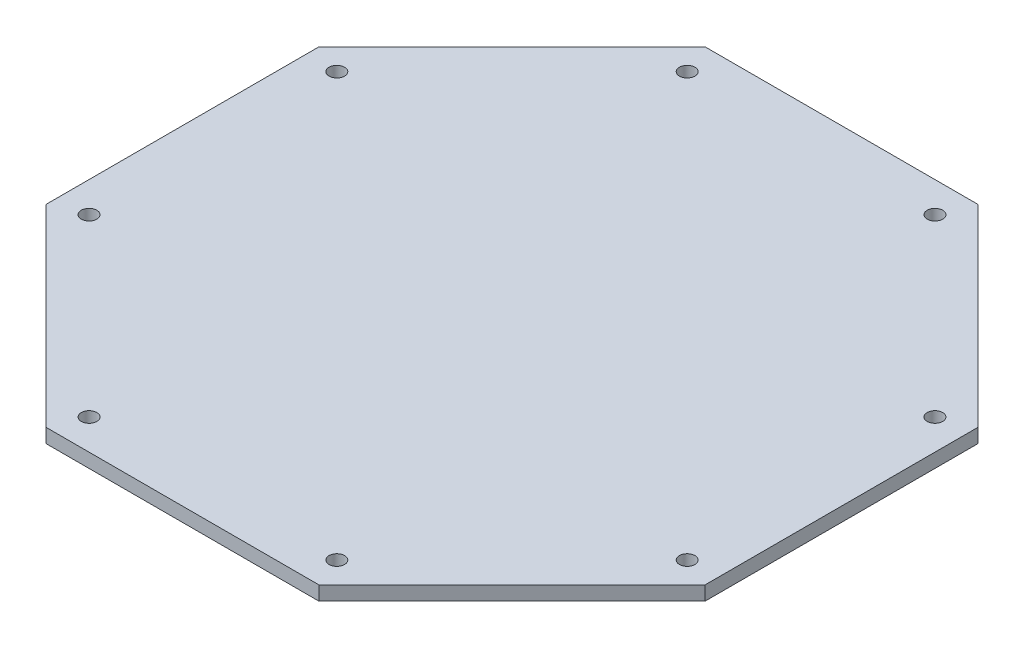
from build123d import *

# Parameters (mm, degrees)
RESSALTO_EXTRUS_O1_DEPTH = 1.5
ESBO_O2_R                = 1.65
CORTE_EXTRUS_O1_DEPTH    = 100.040395799


with BuildPart() as part:
    # Esboço1 → Ressalto-extrusão1 (new, symmetric)
    with BuildSketch(Plane(origin=(0, 0, 0), x_dir=(1, 0, 0), z_dir=(0, 1, 0))):
        Polygon((70, 28.994949366), (28.994949366, 70), (-28.994949366, 70), (-70, 28.994949366), (-70, -28.994949366), (-28.994949366, -70), (28.994949366, -70), (70, -28.994949366), align=None)
    extrude(amount=RESSALTO_EXTRUS_O1_DEPTH, both=True)

    # Esboço2 → Corte-extrusão1 (cut, through all)
    with BuildSketch(Plane.XZ.offset(1.5)):
        with Locations((-26.31616534, 63.532843272)):
            Circle(ESBO_O2_R)
        with Locations((26.31616534, 63.532843272)):
            Circle(ESBO_O2_R)
        with Locations((63.532843272, 26.31616534)):
            Circle(ESBO_O2_R)
        with Locations((63.532843272, -26.31616534)):
            Circle(ESBO_O2_R)
        with Locations((26.31616534, -63.532843272)):
            Circle(ESBO_O2_R)
        with Locations((-26.31616534, -63.532843272)):
            Circle(ESBO_O2_R)
        with Locations((-63.532843272, 26.31616534)):
            Circle(ESBO_O2_R)
        with Locations((-63.532843272, -26.31616534)):
            Circle(ESBO_O2_R)
    extrude(amount=-CORTE_EXTRUS_O1_DEPTH, mode=Mode.SUBTRACT)


solid = part.part
